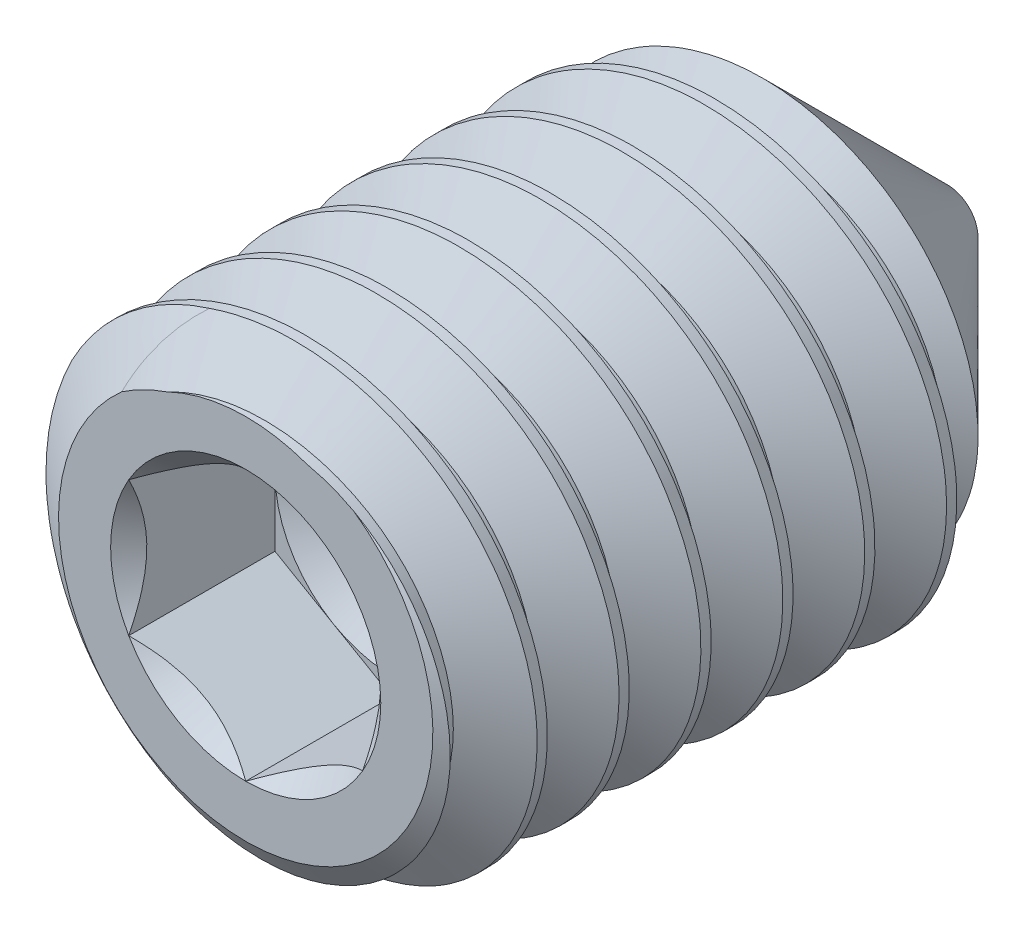
from build123d import *

# Parameters (mm, degrees)
HEX_EXTRUDE_DEPTH  = 1.25
THREAD_SWEEP_PITCH = 0.7


with BuildPart() as part:
    # Body Sketch → Body Revolve (revolve)
    with BuildSketch(Plane(origin=(0, 0, 0), x_dir=(0, 0, -1), z_dir=(1, 0, 0)), mode=Mode.PRIVATE) as body_revolve_sk:
        Polygon((-3, 0), (-3, 1.6), (-2.719916985, 2), (1.26, 2), (3, 0.26), (3, 0), align=None)
    revolve(body_revolve_sk.sketch.rotate(Axis((0, 0, -3), (0, 0, 1)), 90), axis=Axis((0, 0, -3), (0, 0, 1)))

    # Hex Sketch → Hex Extrude (cut)
    with BuildSketch(Plane.XY.offset(3)):
        Polygon((0, 1.154700538), (-1, 0.577350269), (-1, -0.577350269), (0, -1.154700538), (1, -0.577350269), (1, 0.577350269), align=None)
    extrude(amount=-HEX_EXTRUDE_DEPTH, mode=Mode.SUBTRACT)

    # Hex Entry Extrude cone 1 section (through the dimple's axis) → Hex Entry Extrude (revolve, cut)
    with BuildSketch(Plane(origin=(0, 0, 3), x_dir=(0, -1, 0), z_dir=(1, 0, 0))):
        Polygon((0, 0), (1.154700538, 0), (0, 1.154700538), align=None)
    revolve(axis=Axis((0, 0, 3), (0, 0, -1)), mode=Mode.SUBTRACT)

    # Hex Bottom Extrude cone 1 section (through the dimple's axis) → Hex Bottom Extrude (revolve, cut)
    with BuildSketch(Plane(origin=(0, 0, 1.75), x_dir=(0, -1, 0), z_dir=(1, 0, 0))):
        Polygon((0, 0), (1, 0), (0, 0.577350269), align=None)
    revolve(axis=Axis((0, 0, 1.75), (0, 0, -1)), mode=Mode.SUBTRACT)

    # Thread Sweep: the profile of Sketch28 profile screwed along a right-hand helix of 9.571429 turns, 6 arcs to a turn; built about Z, then put on its axis
    thread_sweep_z = Axis((0, 0, 0), (0, 0, 1))
    thread_sweep_corners = [(2.0003, 0, 0.000173205), (2.0003, 0, -0.612673205), (1.545336663, 0, -0.35), (1.545336663, 0, -0.2625)]
    with BuildLine(mode=Mode.PRIVATE) as thread_sweep_profile:
        Line(thread_sweep_corners[0], thread_sweep_corners[1])
        Line(thread_sweep_corners[1], thread_sweep_corners[2])
        Line(thread_sweep_corners[2], thread_sweep_corners[3])
        Line(thread_sweep_corners[3], thread_sweep_corners[0])
    thread_sweep_cap = Face(thread_sweep_profile.wire())
    thread_sweep_turn_angles = [0, 30, 60, 90, 120, 150, 180, 210, 240, 270, 300, 330, 360]
    thread_sweep_turn_weights = [1, 0.8660254037844387, 1, 0.8660254037844387, 1, 0.8660254037844387, 1, 0.8660254037844387, 1, 0.8660254037844387, 1, 0.8660254037844387, 1]
    thread_sweep_turn_rails = [Edge.make_bspline([Vector(p[0], p[1], 0).rotate(thread_sweep_z, thread_sweep_turn_angles[k]) / thread_sweep_turn_weights[k] + Vector(0, 0, p[2] + THREAD_SWEEP_PITCH * thread_sweep_turn_angles[k] / 360) for k in range(13)], [0, 0, 0, 1, 1, 2, 2, 3, 3, 4, 4, 5, 5, 6, 6, 6], 2, thread_sweep_turn_weights) for p in thread_sweep_corners]
    thread_sweep_turn_sides = [Face.make_surface_from_curves(thread_sweep_turn_rails[p[0]], thread_sweep_turn_rails[p[1]]) for p in [(0, 1), (1, 2), (2, 3), (3, 0)]]
    thread_sweep_last_angles = [3240, 3270, 3300, 3330, 3360, 3390, 3420, 3432.857142857, 3445.714285714]
    thread_sweep_last_weights = [1, 0.8660254037844387, 1, 0.8660254037844387, 1, 0.8660254037844387, 1, 0.9749279121818508, 1]
    thread_sweep_last_rails = [Edge.make_bspline([Vector(p[0], p[1], 0).rotate(thread_sweep_z, thread_sweep_last_angles[k]) / thread_sweep_last_weights[k] + Vector(0, 0, p[2] + THREAD_SWEEP_PITCH * thread_sweep_last_angles[k] / 360) for k in range(9)], [0, 0, 0, 1, 1, 2, 2, 3, 3, 4, 4, 4], 2, thread_sweep_last_weights) for p in thread_sweep_corners]
    thread_sweep_last_sides = [Face.make_surface_from_curves(thread_sweep_last_rails[p[0]], thread_sweep_last_rails[p[1]]) for p in [(0, 1), (1, 2), (2, 3), (3, 0)]]
    thread_sweep = Plane(origin=(0, 0, -3), x_dir=(0, 1, 0), z_dir=(0, 0, 1)) * Solid(Shell([*[p.moved(Location((0, 0, THREAD_SWEEP_PITCH * i))) for i in range(9) for p in thread_sweep_turn_sides], *thread_sweep_last_sides, thread_sweep_cap, thread_sweep_cap.rotate(thread_sweep_z, 3445.714285714).moved(Location((0, 0, THREAD_SWEEP_PITCH * 3445.714285714 / 360)))]))
    add(thread_sweep, mode=Mode.SUBTRACT)


solid = part.part
